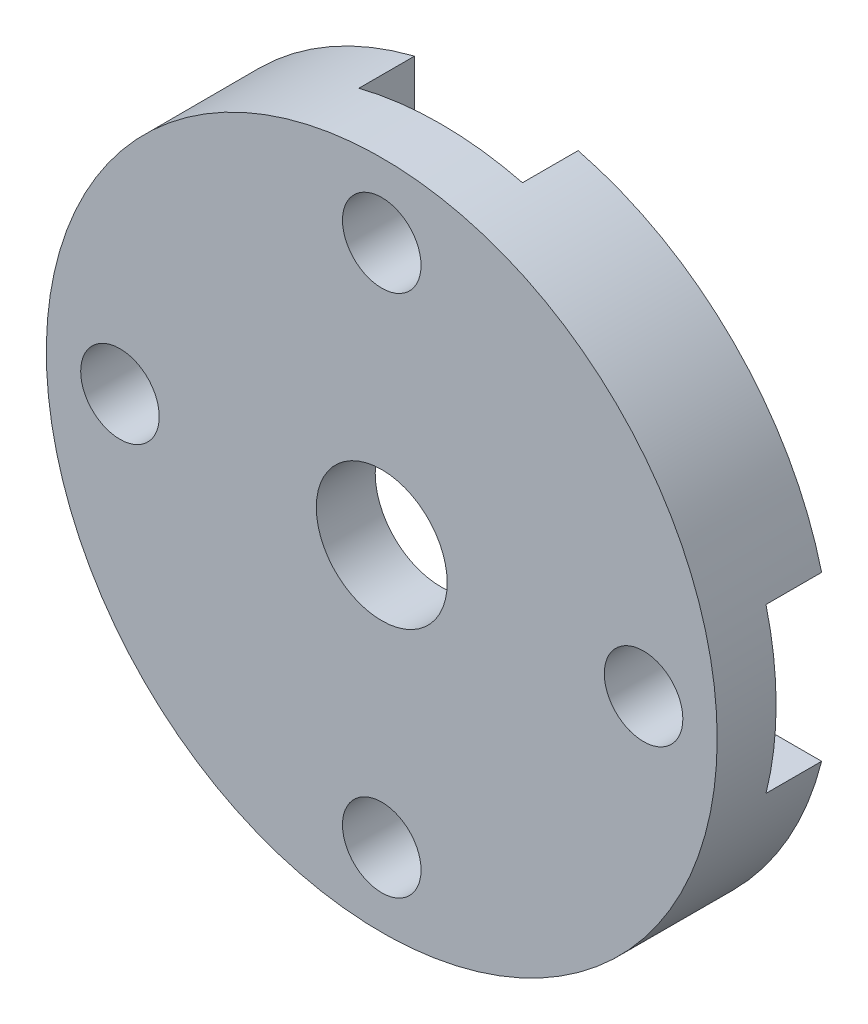
from build123d import *

# Parameters (mm, degrees)
SKETCH1_R              = 10.25
SKETCH1_R_2            = 2
SKETCH1_R_3            = 1.2
BOSS_EXTRUDE1_DEPTH    = 3.5
CUT_EXTRUDE2_START     = -1.7
CUT_EXTRUDE2_OUTLINE_R = 1.2
CUT_EXTRUDE2_DEPTH     = 1.7
SKETCH6_R              = 8
CUT_EXTRUDE4_DEPTH     = 1.7


# Read off the part's stored shape, not the designer's step: Cut-Extrude2
with BuildPart() as part:
    # Sketch1 → Boss-Extrude1 (new body)
    with BuildSketch(Plane.XY):
        Circle(SKETCH1_R)
        Circle(SKETCH1_R_2, mode=Mode.SUBTRACT)
        with Locations((0, 8)):
            Circle(SKETCH1_R_3, mode=Mode.SUBTRACT)
        with Locations((8, 0)):
            Circle(SKETCH1_R_3, mode=Mode.SUBTRACT)
        with Locations((0, -8)):
            Circle(SKETCH1_R_3, mode=Mode.SUBTRACT)
        with Locations((-8, 0)):
            Circle(SKETCH1_R_3, mode=Mode.SUBTRACT)
    extrude(amount=BOSS_EXTRUDE1_DEPTH)

    # Cut-Extrude2 outline → Cut-Extrude2 (cut)
    # profile 1 of 4: a face of its own
    with BuildSketch(Plane(origin=(0, 0, 0), x_dir=(-1, 0, 0), z_dir=(0, 0, -1)).offset(CUT_EXTRUDE2_START)):
        with BuildLine():
            Line((-9.94069912, -2.499), (-8.098979998, -2.499))
            ThreePointArc((-8.098979998, -2.499), (-5.49948025, -0.050000196), (-8.000999999, 2.4989992))
            Line((-8.000999999, 2.4989992), (-9.940699321, 2.4989992))
            ThreePointArc((-9.940699321, 2.4989992), (-10.25, -4.12e-07), (-9.94069912, -2.499))
        make_face()
        with Locations((-8, 0)):
            Circle(CUT_EXTRUDE2_OUTLINE_R, mode=Mode.SUBTRACT)
    # profile 2 of 4: a face of its own
    with BuildSketch(Plane(origin=(0, 0, 0), x_dir=(-1, 0, 0), z_dir=(0, 0, -1)).offset(CUT_EXTRUDE2_START)):
        with BuildLine():
            Line((-2.498, -8), (-2.498, -9.940950458))
            ThreePointArc((-2.498, -9.940950458), (0.001546691, -10.249999883), (2.501, -9.940196125))
            Line((2.501, -9.940196125), (2.5010004, -8.070689462))
            ThreePointArc((2.5010004, -8.070689462), (0.037348265, -5.500249912), (-2.498, -8))
        make_face()
        with Locations((0, -8)):
            Circle(CUT_EXTRUDE2_OUTLINE_R, mode=Mode.SUBTRACT)
    # profile 3 of 4: a face of its own
    with BuildSketch(Plane(origin=(0, 0, 0), x_dir=(-1, 0, 0), z_dir=(0, 0, -1)).offset(CUT_EXTRUDE2_START)):
        with BuildLine():
            ThreePointArc((2.5, 9.940447676), (0, 10.25), (-2.5, 9.940447676))
            Line((-2.5, 9.940447676), (-2.5, 8))
            ThreePointArc((-2.5, 8), (0, 5.5), (2.5, 8))
            Line((2.5, 8), (2.5, 9.940447676))
        make_face()
        with Locations((0, 8)):
            Circle(CUT_EXTRUDE2_OUTLINE_R, mode=Mode.SUBTRACT)
    # profile 4 of 4: a face of its own
    with BuildSketch(Plane(origin=(0, 0, 0), x_dir=(-1, 0, 0), z_dir=(0, 0, -1)).offset(CUT_EXTRUDE2_START)):
        with BuildLine():
            Line((8.001, -2.499), (9.94069912, -2.499))
            ThreePointArc((9.94069912, -2.499), (10.249999948, 0.001031141), (9.940196125, 2.501))
            Line((9.940196125, 2.501), (8.001, 2.501))
            ThreePointArc((8.001, 2.501), (5.501, 0.001), (8.001, -2.499))
        make_face()
        with Locations((8, 0)):
            Circle(CUT_EXTRUDE2_OUTLINE_R, mode=Mode.SUBTRACT)
    extrude(amount=CUT_EXTRUDE2_DEPTH, mode=Mode.SUBTRACT)

    # Sketch6 → Cut-Extrude4 (cut)
    with BuildSketch(Plane(origin=(0, 0, 0), x_dir=(-1, 0, 0), z_dir=(0, 0, -1))):
        Circle(SKETCH6_R)
    extrude(amount=-CUT_EXTRUDE4_DEPTH, mode=Mode.SUBTRACT)


solid = part.part
